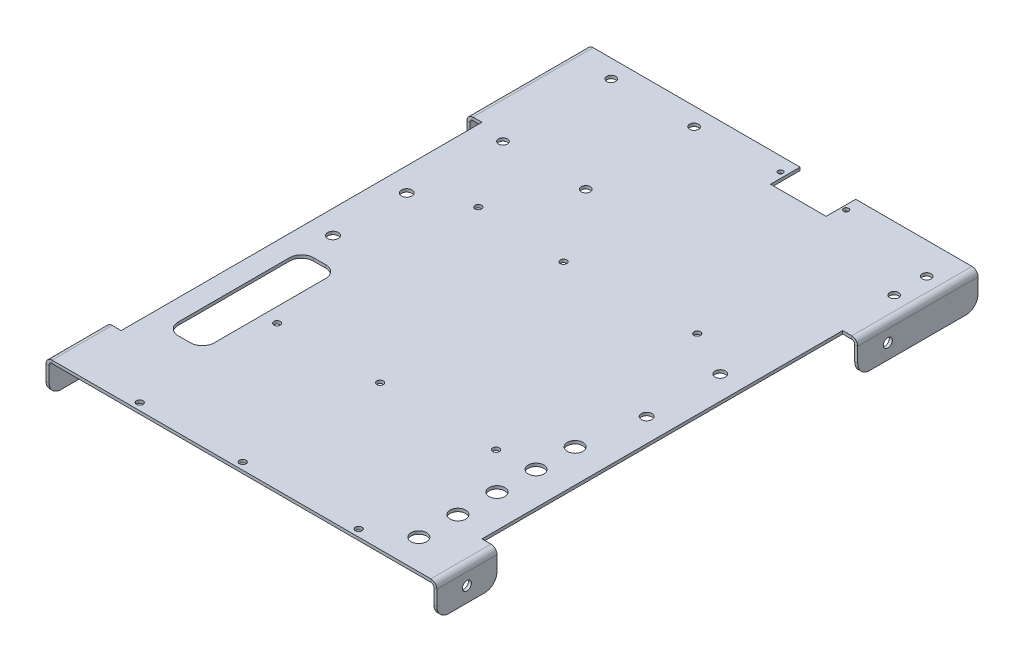
from build123d import *

# Parameters (mm, degrees)
BOSS_EXTRUDE1_DEPTH    = 228.6
CONVERT_SOLID1_START   = -228.6
CONVERT_SOLID1_DEPTH   = 228.6
CONVERT_SOLID1_2_DEPTH = 228.6
SKETCH2_W              = 67.692558519
SKETCH2_H              = 152.4
SKETCH2_W_2            = 75.962864449
CUT_EXTRUDE1_DEPTH     = 244.449426781
SKETCH3_R              = 1.89865
CUT_EXTRUDE2_DEPTH     = 283.088699526
SKETCH4_R              = 2.2225
SKETCH4_R_2            = 1.89865
CUT_EXTRUDE3_DEPTH     = 244.449426781
SKETCH5_R              = 1.89865
CUT_EXTRUDE4_DEPTH     = 244.449426781
CUT_EXTRUDE5_DEPTH     = 244.379852289
SKETCH7_R              = 1.1
SKETCH7_R_2            = 1.05
CUT_EXTRUDE6_DEPTH     = 244.449426781
SKETCH8_R              = 1.37499852
CUT_EXTRUDE7_DEPTH     = 244.449426781
CUT_EXTRUDE8_DEPTH     = 244.449426781
SKETCH10_R             = 3.3
CUT_EXTRUDE9_DEPTH     = 244.449426781
FILLET1_R              = 5.08


# Read off the part's stored shape, not the designer's step: Convert-Solid1
with BuildPart() as part:
    # Sketch1 → Boss-Extrude1 (new body)
    with BuildSketch(Plane.XY):
        Polygon((82.55, 7.62), (82.55, -6.35), (81.28, -6.35), (81.28, 6.35), (-81.28, 6.35), (-81.28, -6.35), (-82.55, -6.35), (-82.55, 7.62), align=None)
    extrude(amount=-BOSS_EXTRUDE1_DEPTH)

    # Convert-Solid1 outline → Convert-Solid1 (cut)
    with BuildSketch(Plane.XY.offset(CONVERT_SOLID1_START)):
        with BuildLine():
            Line((82.55, 7.62), (80.01, 7.62))
            ThreePointArc((80.01, 7.62), (81.806051224, 6.876051224), (82.55, 5.08))
            Line((82.55, 5.08), (82.55, 7.62))
        make_face()
        with BuildLine():
            ThreePointArc((-82.55, 5.08), (-81.806051224, 6.876051224), (-80.01, 7.62))
            Line((-80.01, 7.62), (-82.55, 7.62))
            Line((-82.55, 7.62), (-82.55, 5.08))
        make_face()
    extrude(amount=CONVERT_SOLID1_DEPTH, mode=Mode.SUBTRACT)

    # Convert-Solid1 2 outline → Convert-Solid1 2 (add)
    with BuildSketch(Plane.XY.offset(CONVERT_SOLID1_START)):
        with BuildLine():
            Line((81.28, 6.35), (80.01, 6.35))
            ThreePointArc((80.01, 6.35), (80.908025612, 5.978025612), (81.28, 5.08))
            Line((81.28, 5.08), (81.28, 6.35))
        make_face()
        with BuildLine():
            ThreePointArc((-81.28, 5.08), (-80.908025612, 5.978025612), (-80.01, 6.35))
            Line((-80.01, 6.35), (-81.28, 6.35))
            Line((-81.28, 6.35), (-81.28, 5.08))
        make_face()
    extrude(amount=CONVERT_SOLID1_2_DEPTH)

    # Sketch2 → Cut-Extrude1 (cut, through all)
    with BuildSketch(Plane(origin=(0, 7.62, 0), x_dir=(1, 0, 0), z_dir=(0, 1, 0))):
        with Locations((-110.04627926, 101.6)):
            Rectangle(SKETCH2_W, SKETCH2_H)
        with Locations((114.181432225, 101.6)):
            Rectangle(SKETCH2_W_2, SKETCH2_H)
    extrude(amount=-CUT_EXTRUDE1_DEPTH, mode=Mode.SUBTRACT)

    # Sketch3 → Cut-Extrude2 (cut, through all)
    with BuildSketch(Plane.ZY.offset(82.55)):
        with Locations((-12.7, 0)):
            Circle(SKETCH3_R)
        with Locations((-190.498941664, 0)):
            Circle(SKETCH3_R)
    extrude(amount=-CUT_EXTRUDE2_DEPTH, mode=Mode.SUBTRACT)

    # Sketch4 → Cut-Extrude3 (cut, through all)
    with BuildSketch(Plane(origin=(0, 7.62, 0), x_dir=(1, 0, 0), z_dir=(0, 1, 0))):
        with Locations(Location((-66.230388698, 104.935772071, 0), (0, 0, 270))):
            Circle(SKETCH4_R)
        with Locations(Location((-66.230388698, 136.058157483, 0), (0, 0, 270))):
            Circle(SKETCH4_R)
        with Locations(Location((66.230388698, 104.943157483, 0), (0, 0, 270))):
            Circle(SKETCH4_R)
        with Locations(Location((66.230388698, 136.065542896, 0), (0, 0, 270))):
            Circle(SKETCH4_R)
        with Locations(Location((-64.77, 175.26, 0), (0, 0, 270))):
            Circle(SKETCH4_R_2)
        with Locations(Location((-29.765265396, 175.26, 0), (0, 0, 270))):
            Circle(SKETCH4_R_2)
        with Locations(Location((-64.77, 220.98, 0), (0, 0, 270))):
            Circle(SKETCH4_R_2)
        with Locations(Location((-29.765265396, 220.98, 0), (0, 0, 270))):
            Circle(SKETCH4_R_2)
    extrude(amount=-CUT_EXTRUDE3_DEPTH, mode=Mode.SUBTRACT)

    # Sketch5 → Cut-Extrude4 (cut, through all)
    with BuildSketch(Plane(origin=(0, 7.62, 0), x_dir=(1, 0, 0), z_dir=(0, 1, 0))):
        with Locations(Location((74.08, 215.385, 0), (0, 0, 270))):
            Circle(SKETCH5_R)
        with Locations(Location((74.08, 201.669, 0), (0, 0, 270))):
            Circle(SKETCH5_R)
    extrude(amount=-CUT_EXTRUDE4_DEPTH, mode=Mode.SUBTRACT)

    # Sketch6 → Cut-Extrude5 (cut, through all)
    with BuildSketch(Plane.XZ.offset(-6.35)):
        Polygon((7.397693639, -228.6), (7.397693639, -216.1), (30.897693639, -216.1), (30.897693639, -228.6), (32.459774255, -235.098021795), (8.736104366, -236.048499643), (7.834861371, -236.048499643), align=None)
    extrude(amount=-CUT_EXTRUDE5_DEPTH, mode=Mode.SUBTRACT)

    # Sketch7 → Cut-Extrude6 (cut, through all)
    with BuildSketch(Plane(origin=(0, 7.62, 0), x_dir=(1, 0, 0), z_dir=(0, 1, 0))):
        with Locations(Location((32.725, 222.7, 0), (0, 0, 270))):
            Circle(SKETCH7_R)
        with Locations(Location((5.025, 222.7, 0), (0, 0, 270))):
            Circle(SKETCH7_R_2)
    extrude(amount=-CUT_EXTRUDE6_DEPTH, mode=Mode.SUBTRACT)

    # Sketch8 → Cut-Extrude7 (cut, through all)
    with BuildSketch(Plane(origin=(0, 7.62, 0), x_dir=(1, 0, 0), z_dir=(0, 1, 0))):
        with Locations(Location((46.560590793, 146.00004873, 0), (0, 0, 270))):
            Circle(SKETCH8_R)
        with Locations(Location((-7.939606525, 144.005425812, 0), (0, 0, 270))):
            Circle(SKETCH8_R)
        with Locations(Location((-45.939409177, 146.009176787, 0), (0, 0, 270))):
            Circle(SKETCH8_R)
        with Locations(Location((-45.947797121, 61.009177021, 0), (0, 0, 270))):
            Circle(SKETCH8_R)
        with Locations(Location((-2.447795433, 61.004884367, 0), (0, 0, 270))):
            Circle(SKETCH8_R)
        with Locations(Location((46.552202848, 61.000048964, 0), (0, 0, 270))):
            Circle(SKETCH8_R)
        with Locations(Location((46.54647931, 3.000048406, 0), (0, 0, 270))):
            Circle(SKETCH8_R)
        with Locations(Location((-2.453518972, 3.00488381, 0), (0, 0, 270))):
            Circle(SKETCH8_R)
        with Locations(Location((-45.95352066, 3.009176464, 0), (0, 0, 270))):
            Circle(SKETCH8_R)
    extrude(amount=-CUT_EXTRUDE7_DEPTH, mode=Mode.SUBTRACT)

    # Sketch9 → Cut-Extrude8 (cut, through all)
    with BuildSketch(Plane(origin=(0, 7.62, 0), x_dir=(1, 0, 0), z_dir=(0, 1, 0))):
        with BuildLine():
            Line((-62.23, 92.71), (-57.15, 92.71))
            ThreePointArc((-57.15, 92.71), (-53.557897552, 91.222102448), (-52.07, 87.63))
            Line((-52.07, 87.63), (-52.07, 40.64))
            ThreePointArc((-52.07, 40.64), (-53.557897552, 37.047897552), (-57.15, 35.56))
            Line((-57.15, 35.56), (-62.23, 35.56))
            ThreePointArc((-62.23, 35.56), (-65.822102448, 37.047897552), (-67.31, 40.64))
            Line((-67.31, 40.64), (-67.31, 87.63))
            ThreePointArc((-67.31, 87.63), (-65.822102448, 91.222102448), (-62.23, 92.71))
        make_face()
    extrude(amount=-CUT_EXTRUDE8_DEPTH, mode=Mode.SUBTRACT)

    # Sketch10 → Cut-Extrude9 (cut, through all)
    with BuildSketch(Plane(origin=(0, 7.62, 0), x_dir=(1, 0, 0), z_dir=(0, 1, 0))):
        with Locations(Location((62.23, 12.7, 0), (0, 0, 270))):
            Circle(SKETCH10_R)
        with Locations(Location((62.23, 29.21, 0), (0, 0, 270))):
            Circle(SKETCH10_R)
        with Locations(Location((62.23, 45.72, 0), (0, 0, 270))):
            Circle(SKETCH10_R)
        with Locations(Location((62.23, 62.23, 0), (0, 0, 270))):
            Circle(SKETCH10_R)
        with Locations(Location((62.23, 78.74, 0), (0, 0, 270))):
            Circle(SKETCH10_R)
    extrude(amount=-CUT_EXTRUDE9_DEPTH, mode=Mode.SUBTRACT)

    # Fillet1
    fillet1_edges = [part.edges().sort_by_distance(p)[0] for p in [
        (81.915, -6.35, 0),
        (81.915, -6.35, -228.6),
        (-81.915, -6.35, -228.6),
        (-81.915, -6.35, 0),
        (-81.915, -6.35, -25.4),
        (-81.915, -6.35, -177.8),
        (81.915, -6.35, -25.4),
        (81.915, -6.35, -177.8),
    ]]
    fillet(fillet1_edges, radius=FILLET1_R)


solid = part.part
